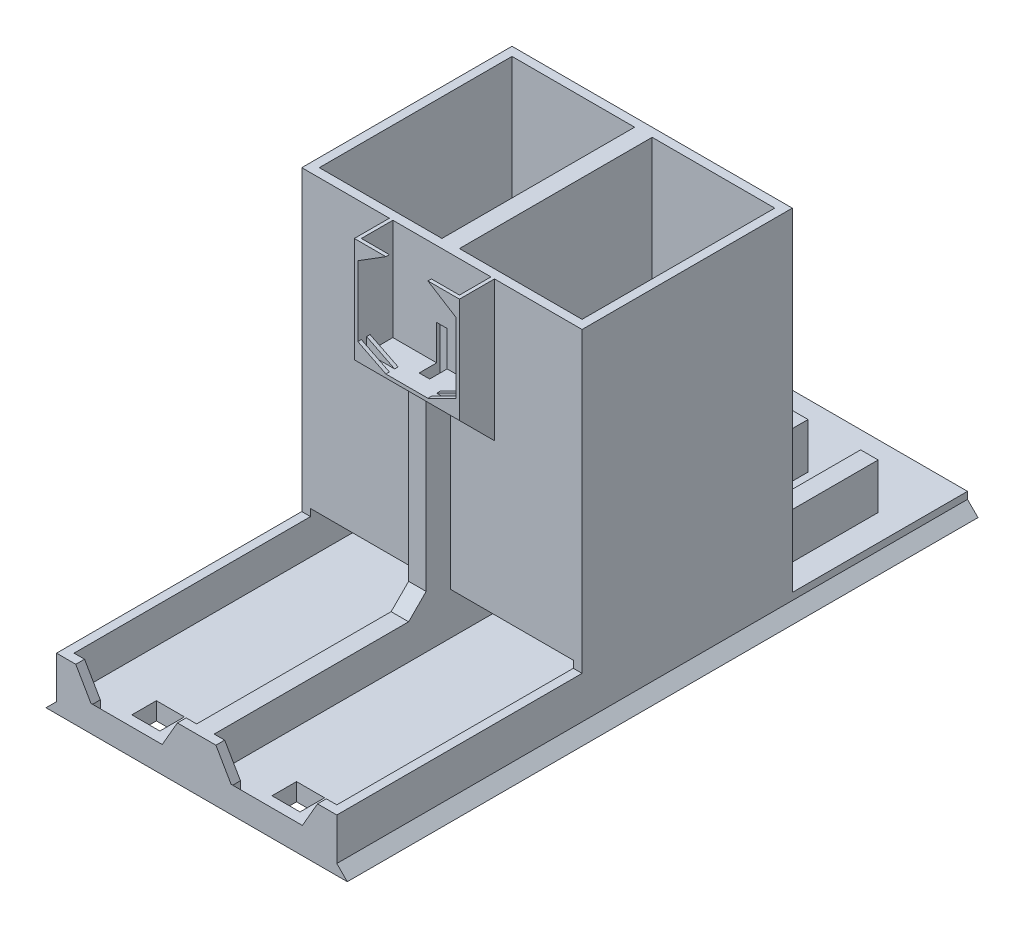
from build123d import *

# Parameters (mm, degrees)
SKETCH1_W                                 = 80
SKETCH1_H                                 = 60
BOSS_EXTRUDE1_DEPTH                       = 100
CUT_EXTRUDE1_START                        = 5
SKETCH2_W                                 = 35
SKETCH2_H                                 = 55
CUT_EXTRUDE1_DEPTH                        = 95
SKETCH3_W                                 = 80
SKETCH3_H                                 = 5
BOSS_EXTRUDE2_DEPTH                       = 70
BOSS_EXTRUDE3_DEPTH                       = 10
SKETCH5_W                                 = 20
SKETCH5_H                                 = 2.5
CUT_EXTRUDE2_DEPTH                        = 7.5
SKETCH6_W                                 = 35
SKETCH6_H                                 = 12
CUT_EXTRUDE4_DEPTH                        = 57.5
CUT_EXTRUDE6_REACH                        = 184.483
SKETCH7_R                                 = 4
SKETCH9_W                                 = 80
SKETCH9_H                                 = 50
BOSS_EXTRUDE4_DEPTH                       = 5
SKETCH13_W                                = 8
SKETCH13_H                                = 7
CUT_EXTRUDE8_BUTTON_HOLES_DEPTH           = 166.90660023
BOSS_EXTRUDE5_OLED_MOUNT_DEPTH            = 10
BOSS_EXTRUDE6_OLED_MOUNT_DEPTH            = 1
BOSS_EXTRUDE7_START                       = -2.5
BOSS_EXTRUDE7_OLED_MOUNT_DEPTH            = 1
BOSS_EXTRUDE8_OLED_MOUNT_DEPTH            = 1
BOSS_EXTRUDE13_OLED_MOUNT_SUPPORT_DEPTH   = 30
CUT_EXTRUDE9_OLED_CABLE_DEPTH             = 10
CUT_EXTRUDE9_OLED_CABLE_DEPTH_BACK        = 154.430766146
SKETCH18_W                                = 3
SKETCH18_H                                = 6
BOSS_EXTRUDE12_OLED_CABLE_GUIDE_REACH     = 162.39
SKETCH20_W                                = 5
SKETCH20_H                                = 5
CUT_EXTRUDE10_SOLENOID_WIRE_HOLE_DEPTH    = 166.90660023
SKETCH21_W                                = 5
SKETCH21_H                                = 32
BOSS_EXTRUDE9_SOLENOID_SIDE_SUPPORT_DEPTH = 13
CHAMFER3_THUMB_SIZE                       = 2.5
CHAMFER5_THUMB_SIZE                       = 4.5
CHAMFER5_THUMB_SIZE2                      = 7.794228634
CHAMFER5_THUMB_PART_2_SIZE                = 4.5
CHAMFER5_THUMB_PART_2_SIZE2               = 7.794228634
CHAMFER5_THUMB_PART_3_SIZE                = 4.5
CHAMFER5_THUMB_PART_3_SIZE2               = 7.794228634
BOSS_EXTRUDE5_GUIDE_DEPTH                 = 180
SKETCH49_W                                = 5
SKETCH49_H                                = 5
BOSS_EXTRUDE14_DEPTH                      = 5
CHAMFER8_SIZE                             = 5


with BuildPart() as part:
    # Sketch1 → Boss-Extrude1 (new body)
    with BuildSketch(Plane(origin=(0, 0, 0), x_dir=(1, 0, 0), z_dir=(0, 1, 0))):
        with Locations((40, 30)):
            Rectangle(SKETCH1_W, SKETCH1_H)
    extrude(amount=BOSS_EXTRUDE1_DEPTH)

    # Sketch2 → Cut-Extrude1 (cut)
    with BuildSketch(Plane(origin=(0, 0, 0), x_dir=(1, 0, 0), z_dir=(0, 1, 0)).offset(CUT_EXTRUDE1_START)):
        with Locations((20, 30)):
            Rectangle(SKETCH2_W, SKETCH2_H)
        with Locations((60, 30)):
            Rectangle(SKETCH2_W, SKETCH2_H)
    extrude(amount=CUT_EXTRUDE1_DEPTH, mode=Mode.SUBTRACT)

    # Sketch3 → Boss-Extrude2 (add)
    with BuildSketch(Plane.XY):
        with Locations((40, 2.5)):
            Rectangle(SKETCH3_W, SKETCH3_H)
    extrude(amount=BOSS_EXTRUDE2_DEPTH)

    # Sketch4 → Boss-Extrude3 (add)
    with BuildSketch(Plane(origin=(0, 5, 0), x_dir=(1, 0, 0), z_dir=(0, 1, 0))):
        Polygon((80, 0), (77.5, 0), (77.5, -67.5), (42.5, -67.5), (42.5, 0), (37.5, 0), (37.5, -67.5), (2.5, -67.5), (2.5, 0), (0, 0), (0, -70), (80, -70), align=None)
    extrude(amount=BOSS_EXTRUDE3_DEPTH)

    # Sketch5 → Cut-Extrude2 (cut)
    with BuildSketch(Plane(origin=(0, 15, 0), x_dir=(1, 0, 0), z_dir=(0, 1, 0))):
        with Locations((20, -68.75)):
            Rectangle(SKETCH5_W, SKETCH5_H)
        with Locations((60, -68.75)):
            Rectangle(SKETCH5_W, SKETCH5_H)
    extrude(amount=-CUT_EXTRUDE2_DEPTH, mode=Mode.SUBTRACT)

    # Sketch6 → Cut-Extrude4 (cut)
    with BuildSketch(Plane.XY):
        with Locations((20, 11)):
            Rectangle(SKETCH6_W, SKETCH6_H)
        with Locations((60, 11)):
            Rectangle(SKETCH6_W, SKETCH6_H)
    extrude(amount=-CUT_EXTRUDE4_DEPTH, mode=Mode.SUBTRACT)

    # Sketch7 → Cut-Extrude6 (cut, up to next)
    with BuildSketch(Plane(origin=(0, 0, -60), x_dir=(-1, 0, 0), z_dir=(0, 0, -1)), mode=Mode.PRIVATE) as cut_extrude6_sk1:
        with Locations((-20, 11.5)):
            Circle(SKETCH7_R)
    cut_extrude6_tool1 = extrude(cut_extrude6_sk1.sketch, amount=-CUT_EXTRUDE6_REACH, mode=Mode.PRIVATE) & part.part
    # Sketch7 → Cut-Extrude6 (cut, up to next)
    with BuildSketch(Plane(origin=(0, 0, -60), x_dir=(-1, 0, 0), z_dir=(0, 0, -1)), mode=Mode.PRIVATE) as cut_extrude6_sk2:
        with Locations((-60, 11.5)):
            Circle(SKETCH7_R)
    cut_extrude6_tool2 = extrude(cut_extrude6_sk2.sketch, amount=-CUT_EXTRUDE6_REACH, mode=Mode.PRIVATE) & part.part
    add(cut_extrude6_tool1.solids().sort_by_distance((20, 11.5, -60))[0], mode=Mode.SUBTRACT)
    add(cut_extrude6_tool2.solids().sort_by_distance((60, 11.5, -60))[0], mode=Mode.SUBTRACT)

    # Sketch9 → Boss-Extrude4 (add)
    with BuildSketch(Plane(origin=(0, 0, 0), x_dir=(1, 0, 0), z_dir=(0, 1, 0))):
        with Locations((40, 85)):
            Rectangle(SKETCH9_W, SKETCH9_H)
    extrude(amount=BOSS_EXTRUDE4_DEPTH)

    # Sketch13 → Cut-Extrude8 (Button Holes) (cut, through all)
    with BuildSketch(Plane(origin=(0, 5, 0), x_dir=(1, 0, 0), z_dir=(0, 1, 0))):
        with Locations((20, -61)):
            Rectangle(SKETCH13_W, SKETCH13_H)
        with Locations((60, -61)):
            Rectangle(SKETCH13_W, SKETCH13_H)
    extrude(amount=-CUT_EXTRUDE8_BUTTON_HOLES_DEPTH, mode=Mode.SUBTRACT)

    # Sketch14 → Boss-Extrude5 (OLED Mount) (add)
    with BuildSketch(Plane.XY):
        Polygon((25, 100), (26, 100), (26, 71), (54, 71), (54, 100), (55, 100), (55, 70), (54, 70), (26, 70), (25, 70), align=None)
    extrude(amount=BOSS_EXTRUDE5_OLED_MOUNT_DEPTH)

    # Sketch15 → Boss-Extrude6 (OLED Mount) (add)
    with BuildSketch(Plane.XY.offset(10)):
        Polygon((26, 71), (34, 71), (26, 75), align=None)
        Polygon((54, 75), (54, 71), (46, 71), align=None)
    extrude(amount=-BOSS_EXTRUDE6_OLED_MOUNT_DEPTH)

    # Sketch15<2> → Boss-Extrude7 (OLED Mount) (add)
    with BuildSketch(Plane.XY.offset(10).offset(BOSS_EXTRUDE7_START)):
        Polygon((26, 71), (34, 71), (26, 75), align=None)
        Polygon((54, 75), (54, 71), (46, 71), align=None)
    extrude(amount=-BOSS_EXTRUDE7_OLED_MOUNT_DEPTH)

    # Sketch17 → Boss-Extrude8 (OLED Mount) (add)
    with BuildSketch(Plane.XY.offset(10)):
        Polygon((54, 95), (54, 100), (46, 100), align=None)
        Polygon((26, 100), (34, 100), (26, 95), align=None)
    extrude(amount=-BOSS_EXTRUDE8_OLED_MOUNT_DEPTH)

    # Sketch32 → Boss-Extrude13 OLED Mount Support) (add)
    with BuildSketch(Plane.ZY.offset(-25)):
        Polygon((0, 70), (10, 70), (0, 60), align=None)
    extrude(amount=-BOSS_EXTRUDE13_OLED_MOUNT_SUPPORT_DEPTH)

    # Sketch18 → Cut-Extrude9 (OLED Cable) (cut, two sides: drawn at the far end of the back side and taken through both)
    with BuildSketch(Plane(origin=(0, 71, 0), x_dir=(1, 0, 0), z_dir=(0, 1, 0)).offset(-CUT_EXTRUDE9_OLED_CABLE_DEPTH_BACK)):
        with Locations((40, -2)):
            Rectangle(SKETCH18_W, SKETCH18_H)
    extrude(amount=CUT_EXTRUDE9_OLED_CABLE_DEPTH + CUT_EXTRUDE9_OLED_CABLE_DEPTH_BACK, mode=Mode.SUBTRACT)

    # Boss-Extrude12 (OLED Cable Guide): up to this plane
    boss_extrude12_oled_cable_guide_end = Plane(origin=(55, 70, 10), z_dir=(0, -0.7071067811865477, 0.7071067811865474))
    # Sketch31 → Boss-Extrude12 (OLED Cable Guide) (add, up to the surface)
    with BuildSketch(Plane(origin=(0, 15, 0), x_dir=(1, 0, 0), z_dir=(0, 1, 0)), mode=Mode.PRIVATE) as boss_extrude12_oled_cable_guide_sk1:
        Polygon((37.5, 0), (38.5, 0), (38.5, -5), (41.5, -5), (41.5, 0), (42.5, 0), (42.5, -7), (37.5, -7), align=None)
    boss_extrude12_oled_cable_guide_tool1 = split(extrude(boss_extrude12_oled_cable_guide_sk1.sketch, amount=BOSS_EXTRUDE12_OLED_CABLE_GUIDE_REACH, mode=Mode.PRIVATE), bisect_by=boss_extrude12_oled_cable_guide_end, keep=Keep.BOTH, mode=Mode.PRIVATE)
    add(boss_extrude12_oled_cable_guide_tool1.solids().sort_by_distance((38, 15, 0.086023))[0])

    # Sketch20 → Cut-Extrude10 (Solenoid Wire Hole) (cut, through all)
    with BuildSketch(Plane(origin=(0, 5, 0), x_dir=(1, 0, 0), z_dir=(0, 1, 0))):
        with Locations((60, 62.5)):
            Rectangle(SKETCH20_W, SKETCH20_H)
        with Locations((20, 62.5)):
            Rectangle(SKETCH20_W, SKETCH20_H)
    extrude(amount=-CUT_EXTRUDE10_SOLENOID_WIRE_HOLE_DEPTH, mode=Mode.SUBTRACT)

    # Sketch21 → Boss-Extrude9 (Solenoid Side Support) (add)
    with BuildSketch(Plane(origin=(0, 5, 0), x_dir=(1, 0, 0), z_dir=(0, 1, 0))):
        with Locations((70, 76)):
            Rectangle(SKETCH21_W, SKETCH21_H)
        with Locations((50, 76)):
            Rectangle(SKETCH21_W, SKETCH21_H)
        with Locations((30, 76)):
            Rectangle(SKETCH21_W, SKETCH21_H)
        with Locations((10, 76)):
            Rectangle(SKETCH21_W, SKETCH21_H)
    extrude(amount=BOSS_EXTRUDE9_SOLENOID_SIDE_SUPPORT_DEPTH)

    # Chamfer3 (Thumb)
    chamfer3_thumb_edges = [part.edges().sort_by_distance(p)[0] for p in [
        (20, 7.5, 67.5),
        (60, 7.5, 67.5),
    ]]
    chamfer(chamfer3_thumb_edges, length=CHAMFER3_THUMB_SIZE - 0.0001)  # a hair under: the kernel refuses the full size

    # Chamfer5 (Thumb)
    chamfer5_thumb_edges = [part.edges().sort_by_distance(p)[0] for p in [
        (70, 15, 68.75),
    ]]
    chamfer5_thumb_side = [part.faces().sort_by_distance(p)[0] for p in [
        (78.266129032, 15, 38.266129032),
    ]]
    chamfer(chamfer5_thumb_edges, length=CHAMFER5_THUMB_SIZE, length2=CHAMFER5_THUMB_SIZE2, reference=chamfer5_thumb_side[0])

    # Chamfer5 (Thumb) part 2
    chamfer5_thumb_part_2_edges = [part.edges().sort_by_distance(p)[0] for p in [
        (50, 15, 68.75),
        (30, 15, 68.75),
    ]]
    chamfer5_thumb_part_2_side = [part.faces().sort_by_distance(p)[0] for p in [
        (40, 15, 41.718085106),
    ]]
    chamfer(chamfer5_thumb_part_2_edges, length=CHAMFER5_THUMB_PART_2_SIZE, length2=CHAMFER5_THUMB_PART_2_SIZE2, reference=chamfer5_thumb_part_2_side[0])

    # Chamfer5 (Thumb) part 3
    chamfer5_thumb_part_3_edges = [part.edges().sort_by_distance(p)[0] for p in [
        (10, 15, 68.75),
    ]]
    chamfer5_thumb_part_3_side = [part.faces().sort_by_distance(p)[0] for p in [
        (1.733870968, 15, 38.266129032),
    ]]
    chamfer(chamfer5_thumb_part_3_edges, length=CHAMFER5_THUMB_PART_3_SIZE, length2=CHAMFER5_THUMB_PART_3_SIZE2, reference=chamfer5_thumb_part_3_side[0])

    # Sketch37 → Boss-Extrude5 (Guide) (add, through all)
    with BuildSketch(Plane.XY.offset(70)):
        Polygon((80, 0), (83, 0), (80, 3), align=None)
        Polygon((0, 0), (-3, 0), (0, 3), align=None)
    extrude(amount=-BOSS_EXTRUDE5_GUIDE_DEPTH)

    # Sketch49 → Boss-Extrude14 (add)
    with BuildSketch(Plane(origin=(0, 15, 0), x_dir=(1, 0, 0), z_dir=(0, 1, 0))):
        with Locations((40, -9.5)):
            Rectangle(SKETCH49_W, SKETCH49_H)
    extrude(amount=BOSS_EXTRUDE14_DEPTH)

    # Chamfer8
    chamfer8_edges = [part.edges().sort_by_distance(p)[0] for p in [
        (40, 20, 12),
    ]]
    chamfer(chamfer8_edges, length=CHAMFER8_SIZE - 0.0001)  # a hair under: the kernel refuses the full size


solid = part.part
